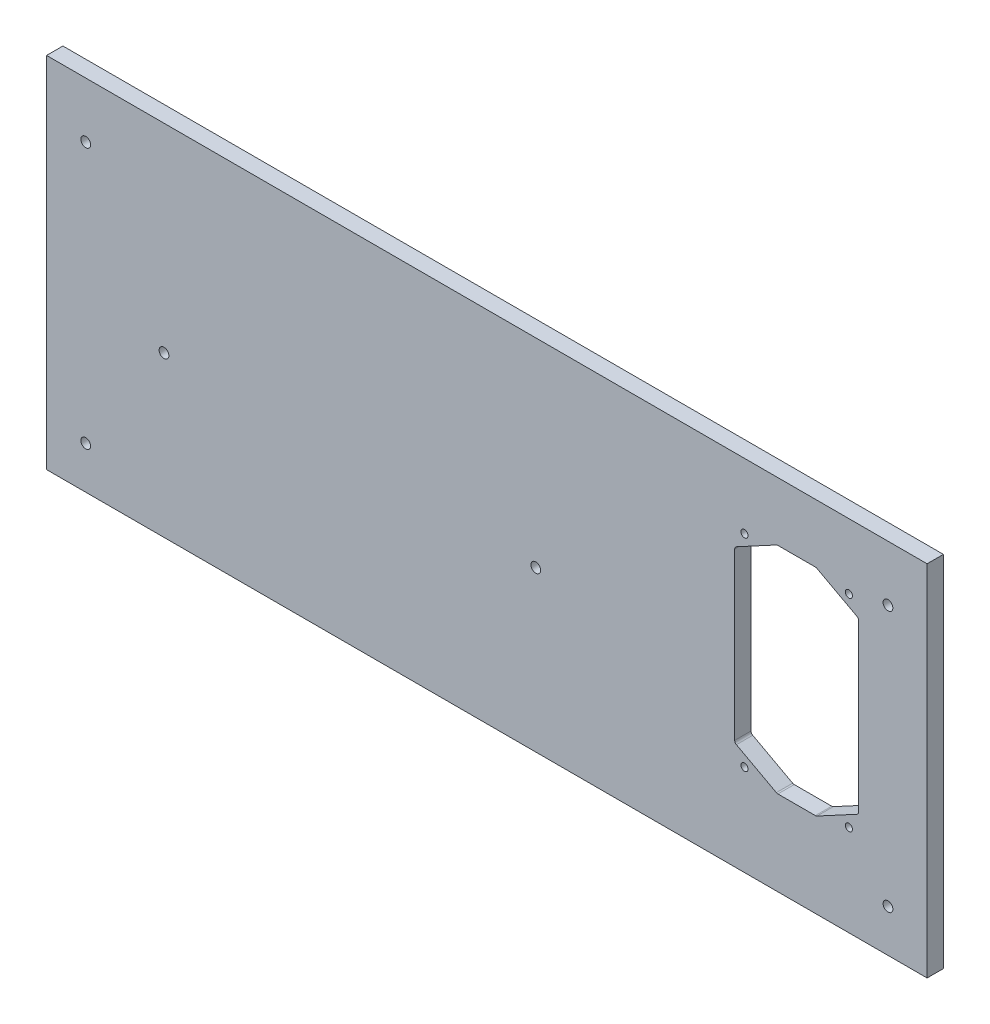
from build123d import *

# Parameters (mm, degrees)
SKETCH1_W             = 270
SKETCH1_H             = 110
BASE_DEPTH            = 2.5
SKETCH2_R             = 1.5
MOUNTHOLES_DEPTH      = 146.859521458
SKETCH3_R             = 1.5
MIDDLEPARTHOLES_DEPTH = 146.859521458
CHAMFERALL_SIZE       = 1.7
SKETCH4_R             = 1.1
CUT_EXTRUDE1_DEPTH    = 146.859521458
FILLET1_R             = 1


with BuildPart() as part:
    # Sketch1 → Base (new, symmetric)
    with BuildSketch(Plane.XY):
        Rectangle(SKETCH1_W, SKETCH1_H)
    extrude(amount=BASE_DEPTH, both=True)

    # Sketch2 → MountHoles (cut, through all)
    with BuildSketch(Plane.XY.offset(2.5)):
        with Locations((-123, -42)):
            Circle(SKETCH2_R)
        with Locations((123, -42)):
            Circle(SKETCH2_R)
        with Locations((123, 38)):
            Circle(SKETCH2_R)
        with Locations((-123, 38)):
            Circle(SKETCH2_R)
    extrude(amount=-MOUNTHOLES_DEPTH, mode=Mode.SUBTRACT)

    # Sketch3 → MiddlePartHoles (cut, through all)
    with BuildSketch(Plane(origin=(0, 0, -2.5), x_dir=(-1, 0, 0), z_dir=(0, 0, -1))):
        with Locations((-15, -6)):
            Circle(SKETCH3_R)
        with Locations((99, -6)):
            Circle(SKETCH3_R)
    extrude(amount=-MIDDLEPARTHOLES_DEPTH, mode=Mode.SUBTRACT)

    # ChamferAll
    chamferall_edges = [part.edges().sort_by_distance(p)[0] for p in [
        (-124.5, -42, -2.5),
        (121.5, -42, -2.5),
        (-124.5, 38, -2.5),
        (121.5, 38, -2.5),
        (-97.5, -6, -2.5),
        (16.5, -6, -2.5),
    ]]
    chamfer(chamferall_edges, length=CHAMFERALL_SIZE)

    # Sketch4 → Cut-Extrude1 (cut, through all)
    with BuildSketch(Plane(origin=(0, 0, -2.5), x_dir=(-1, 0, 0), z_dir=(0, 0, -1))):
        with Locations((-79, 35)):
            Circle(SKETCH4_R)
        with Locations((-111, 35)):
            Circle(SKETCH4_R)
        with Locations((-111, -27)):
            Circle(SKETCH4_R)
        with Locations((-79, -27)):
            Circle(SKETCH4_R)
        Polygon((-101, 37), (-114, 30), (-114, -22), (-101, -29), (-89, -29), (-76, -22), (-76, 30), (-89, 37), align=None)
    extrude(amount=-CUT_EXTRUDE1_DEPTH, mode=Mode.SUBTRACT)

    # Fillet1
    fillet1_edges = [part.edges().sort_by_distance(p)[0] for p in [
        (76, 30, 0),
        (89, -29, 0),
        (101, -29, 0),
        (114, -22, 0),
        (114, 30, 0),
        (101, 37, 0),
        (89, 37, 0),
        (76, -22, 0),
    ]]
    fillet(fillet1_edges, radius=FILLET1_R)


solid = part.part
